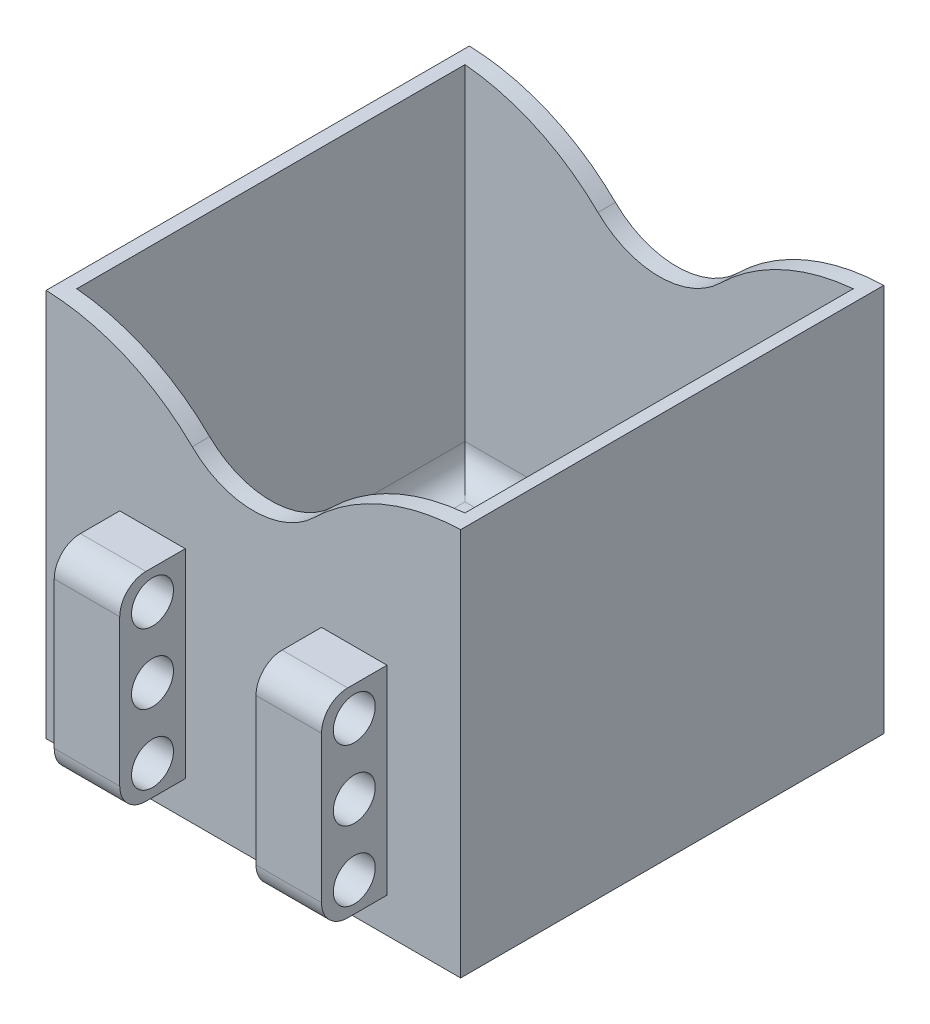
from build123d import *

# Parameters (mm, degrees)
SKETCH1_W               = 47.45
SKETCH1_H               = 48.45
BOSS_EXTRUDE1_DEPTH     = 44.45
SKETCH2_W               = 44.45
SKETCH2_H               = 44.45
CUT_EXTRUDE1_DEPTH      = 40.45
SKETCH3_W               = 7.5
SKETCH3_H               = 22.8
BOSS_EXTRUDE2_DEPTH     = 7.5
SKETCH4_R               = 2.4
CUT_EXTRUDE2_DEPTH      = 67.070738008
FILLET1_R               = 3
SKETCH5_W               = 8.878843291
SKETCH5_H               = 5
BOSS_EXTRUDE3_DEPTH     = 10
FILLET2_R               = 10
FILLET3_R               = 2
FILLET4_R               = 2
FILLET5_R               = 3
SKETCH6_R               = 10
CUT_EXTRUDE3_DEPTH      = 10
CUT_EXTRUDE5_DEPTH      = 83.857410319
CUT_EXTRUDE5_DEPTH_BACK = 83.857410319
FILLET6_R               = 25


# Some blends are built 0.0001 mm under size
with BuildPart() as part:
    # Sketch1 → Boss-Extrude1 (new body)
    with BuildSketch(Plane(origin=(0, 0, 0), x_dir=(1, 0, 0), z_dir=(0, 1, 0))):
        with Locations((-8.217167759, 5.212888782)):
            Rectangle(SKETCH1_W, SKETCH1_H)
    extrude(amount=BOSS_EXTRUDE1_DEPTH)

    # Sketch2 → Cut-Extrude1 (cut)
    with BuildSketch(Plane(origin=(0, 44.45, 0), x_dir=(1, 0, 0), z_dir=(0, 1, 0))):
        with Locations((-8.217167759, 5.212888782)):
            Rectangle(SKETCH2_W, SKETCH2_H)
    extrude(amount=-CUT_EXTRUDE1_DEPTH, mode=Mode.SUBTRACT)

    # Sketch3 → Boss-Extrude2 (add)
    with BuildSketch(Plane.XY.offset(19.012111218)):
        with Locations((-19.767167759, 15.4)):
            Rectangle(SKETCH3_W, SKETCH3_H)
        with Locations((3.332832241, 15.4)):
            Rectangle(SKETCH3_W, SKETCH3_H)
    extrude(amount=BOSS_EXTRUDE2_DEPTH)

    # Sketch4 → Cut-Extrude2 (cut, through all)
    with BuildSketch(Plane(origin=(7.082832241, 0, 0), x_dir=(0, 0, -1), z_dir=(1, 0, 0))):
        with Locations(Location((-22.762111218, 23.4, 0), (0, 0, 90))):
            Circle(SKETCH4_R)
        with Locations(Location((-22.762111218, 7.4, 0), (0, 0, 90))):
            Circle(SKETCH4_R)
        with Locations(Location((-22.762111218, 15.4, 0), (0, 0, 90))):
            Circle(SKETCH4_R)
    extrude(amount=-CUT_EXTRUDE2_DEPTH, mode=Mode.SUBTRACT)

    # Fillet1
    fillet1_edges = [part.edges().sort_by_distance(p)[0] for p in [
        (-19.767167759, 26.8, 26.512111218),
        (-19.767167759, 4, 26.512111218),
        (3.332832241, 26.8, 26.512111218),
        (3.332832241, 4, 26.512111218),
    ]]
    fillet(fillet1_edges, radius=FILLET1_R)

    # Sketch5 → Boss-Extrude3 (add)
    with BuildSketch(Plane.ZY.offset(31.942167759)):
        with Locations((-5.212888782, 2.5)):
            Rectangle(SKETCH5_W, SKETCH5_H)
    extrude(amount=BOSS_EXTRUDE3_DEPTH)

    # Fillet2
    fillet2_edges = [part.edges().sort_by_distance(p)[0] for p in [
        (-31.942167759, 5, -5.212888782),
    ]]
    fillet(fillet2_edges, radius=FILLET2_R - 0.0001)  # a hair under: the kernel refuses the full size

    # Fillet3
    fillet3_edges = [part.edges().sort_by_distance(p)[0] for p in [
        (-41.942167759, 5, -5.212888782),
    ]]
    fillet(fillet3_edges, radius=FILLET3_R)

    # Fillet4
    fillet4_edges = [part.edges().sort_by_distance(p)[0] for p in [
        (-31.942167759, 7.49995, -9.652310427),
        (-31.942167759, 7.49995, -0.773467136),
    ]]
    fillet(fillet4_edges, radius=FILLET4_R)

    # Fillet5
    fillet5_edges = [part.edges().sort_by_distance(p)[0] for p in [
        (-30.442167759, 4, -5.212888782),
        (-8.217167759, 4, -27.437888782),
        (14.007832241, 4, -5.212888782),
        (-8.217167759, 4, 17.012111218),
    ]]
    fillet(fillet5_edges, radius=FILLET5_R)

    # Sketch6 → Cut-Extrude3 (cut)
    with BuildSketch(Plane(origin=(0, 4, 0), x_dir=(1, 0, 0), z_dir=(0, 1, 0))):
        with Locations(Location((-8.217167759, 5.212888782, 0), (0, 0, 270))):
            Circle(SKETCH6_R)
    extrude(amount=-CUT_EXTRUDE3_DEPTH, mode=Mode.SUBTRACT)

    # Sketch7 → Cut-Extrude5 (cut, two sides: drawn at the far end of the back side and taken through both)
    with BuildSketch(Plane(origin=(0, 0, -29.437888782), x_dir=(-1, 0, 0), z_dir=(0, 0, -1)).offset(-CUT_EXTRUDE5_DEPTH_BACK)):
        with BuildLine():
            Line((18.217167759, 179.152496248), (18.217167759, 44.45))
            ThreePointArc((18.217167759, 44.45), (8.217167759, 34.45), (-1.782832241, 44.45))
            Line((-1.782832241, 44.45), (-1.782832241, 179.152496248))
            Line((-1.782832241, 179.152496248), (-1.782832241, 448.557488745))
            Line((-1.782832241, 448.557488745), (18.217167759, 448.557488745))
            Line((18.217167759, 448.557488745), (18.217167759, 179.152496248))
        make_face()
    extrude(amount=CUT_EXTRUDE5_DEPTH + CUT_EXTRUDE5_DEPTH_BACK, mode=Mode.SUBTRACT)

    # Fillet6
    # the kernel refuses this fillet: 25 mm, written as the material it takes off along each edge
    with BuildSketch(Plane(origin=(1.782832241, 44.45, -17.300388782), x_dir=(1, 0, 0), z_dir=(0, 0, 1)), Plane(origin=(1.782832241, 44.45, -63.750388782), x_dir=(1, 0, 0), z_dir=(0, 0, 1))) as fillet6_piece_1:
        with BuildLine():
            CenterArc((14.507389357, -24.987754339), FILLET6_R, 91.793397152, 42.650547852)
            Line((-2.997888755, -7.139358382), (-3.347994317, -6.782390463))
            ThreePointArc((-3.347994317, -6.782390463), (-1.240888915, -3.678039288), (-0.5, 0))
            Line((-0.5, 0), (0, 0.5))
            ThreePointArc((0, 0.5), (6.8625, 0.5), (13.709352213, 0.499755087))
            Line((13.709352213, 0.499755087), (13.725, 0))
        make_face()
    extrude(amount=70.625, mode=Mode.SUBTRACT)
    with BuildSketch(Plane(origin=(-18.217167759, 44.45, -17.300388782), x_dir=(-1, 0, 0), z_dir=(0, 0, 1)), Plane(origin=(-18.217167759, 44.45, -63.750388782), x_dir=(-1, 0, 0), z_dir=(0, 0, 1))) as fillet6_piece_2:
        with BuildLine():
            CenterArc((14.507389357, 24.987754339), FILLET6_R, 225.556054997, 42.650547852)
            Line((-2.997888755, 7.139358382), (-3.347994317, 6.782390463))
            ThreePointArc((-3.347994317, 6.782390463), (-1.240888915, 3.678039288), (-0.5, 0))
            Line((-0.5, 0), (0, -0.5))
            ThreePointArc((0, -0.5), (6.8625, -0.5), (13.709352213, -0.499755087))
            Line((13.709352213, -0.499755087), (13.725, 0))
        make_face()
    extrude(amount=70.625, mode=Mode.SUBTRACT)


solid = part.part
